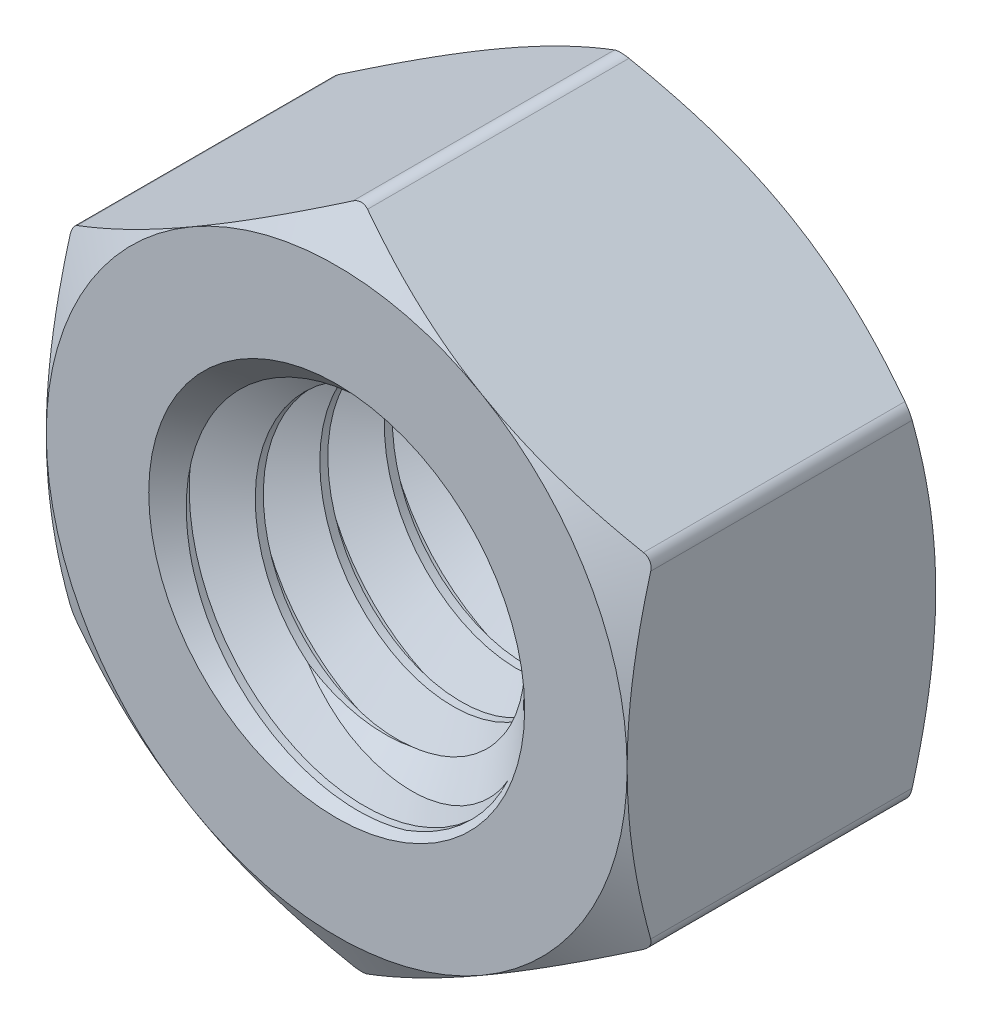
from build123d import *

# Parameters (mm, degrees)
BOSS_EXTRUDE2_DEPTH     = 3.3734375
CUT_EXTRUDE4_DEPTH      = 11.269659873
CUT_EXTRUDE4_DEPTH_BACK = 11.269659873
SKETCH16_R              = 3.96875
SKETCH7_OUTSIDE_W       = 63.202
SKETCH7_OUTSIDE_H       = 65.166
SKETCH7_OUTSIDE_R       = 6.35
CUT_EXTRUDE5_DEPTH      = 12.815504881
CUT_EXTRUDE5_DRAFT      = -60
MIRROR4_COPY_1_SKETCH_W = 63.202
MIRROR4_COPY_1_SKETCH_H = 65.166
MIRROR4_COPY_1_SKETCH_R = 6.35
MIRROR4_COPY_1_DEPTH    = 12.815504881
MIRROR4_COPY_1_DRAFT    = -60
FILLET2_R               = 0.3175
SKETCH13_R              = 3.96875
BOSS_EXTRUDE1_DEPTH     = 6.746875
CUT_SWEEP1_PITCH        = 1.411111111
SKETCH17_R              = 3.96875
BOSS_EXTRUDE3_DEPTH     = 6.746875


with BuildPart() as part:
    # Sketch15 → Boss-Extrude2 (new, symmetric)
    with BuildSketch(Plane.XY):
        Polygon((0, 7.332348419), (-6.35, 3.666174209), (-6.35, -3.666174209), (0, -7.332348419), (6.35, -3.666174209), (6.35, 3.666174209), align=None)
    extrude(amount=BOSS_EXTRUDE2_DEPTH, both=True)

    # Sketch16 → Cut-Extrude4 (cut, two sides: drawn at the far end of the back side and taken through both)
    with BuildSketch(Plane.XY.offset(-CUT_EXTRUDE4_DEPTH_BACK)):
        Circle(SKETCH16_R)
    extrude(amount=CUT_EXTRUDE4_DEPTH + CUT_EXTRUDE4_DEPTH_BACK, mode=Mode.SUBTRACT)


with BuildPart() as cut_extrude5_tool:
    # Sketch7 outside → Cut-Extrude5 (with draft: the straight prism first)
    with BuildSketch(Plane.XY.offset(3.3734375)):
        Rectangle(SKETCH7_OUTSIDE_W, SKETCH7_OUTSIDE_H)
        Circle(SKETCH7_OUTSIDE_R, mode=Mode.SUBTRACT)
    extrude(amount=-CUT_EXTRUDE5_DEPTH)
    # Cut-Extrude5: the draft: its side faces are tilted about the plane it starts from
    cut_extrude5_sides = [cut_extrude5_tool.faces().sort_by_distance(p)[0] for p in [
        (0, -32.583, -3.034314941),
        (31.601, 0, -3.034314941),
        (0, 32.583, -3.034314941),
        (-31.601, 0, -3.034314941),
        (-6.35, 0, -3.034314941),
    ]]
    draft(cut_extrude5_sides, Plane.XY.offset(3.3734375), CUT_EXTRUDE5_DRAFT)


with BuildPart() as part_1:
    add(part.part)

    # Cut-Extrude5: cut by cut_extrude5_tool
    add(cut_extrude5_tool.part, mode=Mode.SUBTRACT)


with BuildPart() as mirror4_copy_1_tool:
    # Mirror4 copy 1 sketch → Mirror4 copy 1 (with draft: the straight prism first)
    with BuildSketch(Plane(origin=(0, 0, -3.3734375), x_dir=(1, 0, 0), z_dir=(0, 0, -1))):
        Rectangle(MIRROR4_COPY_1_SKETCH_W, MIRROR4_COPY_1_SKETCH_H)
        Circle(MIRROR4_COPY_1_SKETCH_R, mode=Mode.SUBTRACT)
    extrude(amount=-MIRROR4_COPY_1_DEPTH)
    # Mirror4 copy 1: the draft: its side faces are tilted about the plane it starts from
    mirror4_copy_1_sides = [mirror4_copy_1_tool.faces().sort_by_distance(p)[0] for p in [
        (0, -32.583, 3.034314941),
        (31.601, 0, 3.034314941),
        (0, 32.583, 3.034314941),
        (-31.601, 0, 3.034314941),
        (-6.35, 0, 3.034314941),
    ]]
    draft(mirror4_copy_1_sides, Plane(origin=(0, 0, -3.3734375), x_dir=(1, 0, 0), z_dir=(0, 0, -1)), MIRROR4_COPY_1_DRAFT)


with BuildPart() as part_2:
    add(part_1.part)

    # Mirror4 copy 1: cut by mirror4_copy_1_tool
    add(mirror4_copy_1_tool.part, mode=Mode.SUBTRACT)

    # Fillet2
    fillet2_edges = [part_2.edges().sort_by_distance(p)[0] for p in [
        (-6.35, 3.666174209, 0),
        (-6.35, -3.666174209, 0),
        (0, -7.332348419, 0),
        (6.35, -3.666174209, 0),
        (6.35, 3.666174209, 0),
        (0, 7.332348419, 0),
    ]]
    fillet(fillet2_edges, radius=FILLET2_R)

    # Sketch17 → Boss-Extrude3 (add)
    with BuildSketch(Plane.XY.offset(3.3734375)):
        Circle(SKETCH17_R)
    extrude(amount=-BOSS_EXTRUDE3_DEPTH)


with BuildPart() as body_2:
    # Sketch13 → Boss-Extrude1 (new body)
    with BuildSketch(Plane(origin=(0, 0, -3.3734375), x_dir=(-1, 0, 0), z_dir=(0, 0, -1))):
        Circle(SKETCH13_R)
    extrude(amount=-BOSS_EXTRUDE1_DEPTH)

    # Cut-Sweep1: the profile of Sketch12 profile screwed along a right-hand helix of 5.78125 turns, 8 arcs to a turn; built about Z, then put on its axis
    cut_sweep1_z = Axis((0, 0, 0), (0, 0, 1))
    cut_sweep1_corners = [(3.96905, 0, -1.234895427), (3.96905, 0, 0.000173205), (3.052206448, 0, -0.529166667), (3.052206448, 0, -0.705555556)]
    with BuildLine(mode=Mode.PRIVATE) as cut_sweep1_profile:
        Line(cut_sweep1_corners[0], cut_sweep1_corners[1])
        Line(cut_sweep1_corners[1], cut_sweep1_corners[2])
        Line(cut_sweep1_corners[2], cut_sweep1_corners[3])
        Line(cut_sweep1_corners[3], cut_sweep1_corners[0])
    cut_sweep1_cap = Face(cut_sweep1_profile.wire())
    cut_sweep1_turn_angles = [0, 22.5, 45, 67.5, 90, 112.5, 135, 157.5, 180, 202.5, 225, 247.5, 270, 292.5, 315, 337.5, 360]
    cut_sweep1_turn_weights = [1, 0.9238795325112867, 1, 0.9238795325112867, 1, 0.9238795325112867, 1, 0.9238795325112867, 1, 0.9238795325112867, 1, 0.9238795325112867, 1, 0.9238795325112867, 1, 0.9238795325112867, 1]
    cut_sweep1_turn_rails = [Edge.make_bspline([Vector(p[0], p[1], 0).rotate(cut_sweep1_z, cut_sweep1_turn_angles[k]) / cut_sweep1_turn_weights[k] + Vector(0, 0, p[2] + CUT_SWEEP1_PITCH * cut_sweep1_turn_angles[k] / 360) for k in range(17)], [0, 0, 0, 1, 1, 2, 2, 3, 3, 4, 4, 5, 5, 6, 6, 7, 7, 8, 8, 8], 2, cut_sweep1_turn_weights) for p in cut_sweep1_corners]
    cut_sweep1_turn_sides = [Face.make_surface_from_curves(cut_sweep1_turn_rails[p[0]], cut_sweep1_turn_rails[p[1]]) for p in [(0, 1), (1, 2), (2, 3), (3, 0)]]
    cut_sweep1_last_angles = [1800, 1822.5, 1845, 1867.5, 1890, 1912.5, 1935, 1957.5, 1980, 2002.5, 2025, 2047.5, 2070, 2075.625, 2081.25]
    cut_sweep1_last_weights = [1, 0.9238795325112867, 1, 0.9238795325112867, 1, 0.9238795325112867, 1, 0.9238795325112867, 1, 0.9238795325112867, 1, 0.9238795325112867, 1, 0.9951847266722058, 1]
    cut_sweep1_last_rails = [Edge.make_bspline([Vector(p[0], p[1], 0).rotate(cut_sweep1_z, cut_sweep1_last_angles[k]) / cut_sweep1_last_weights[k] + Vector(0, 0, p[2] + CUT_SWEEP1_PITCH * cut_sweep1_last_angles[k] / 360) for k in range(15)], [0, 0, 0, 1, 1, 2, 2, 3, 3, 4, 4, 5, 5, 6, 6, 7, 7, 7], 2, cut_sweep1_last_weights) for p in cut_sweep1_corners]
    cut_sweep1_last_sides = [Face.make_surface_from_curves(cut_sweep1_last_rails[p[0]], cut_sweep1_last_rails[p[1]]) for p in [(0, 1), (1, 2), (2, 3), (3, 0)]]
    cut_sweep1 = Plane(origin=(0, 0, -3.3734375), x_dir=(0, 1, 0), z_dir=(0, 0, 1)) * Solid(Shell([*[p.moved(Location((0, 0, CUT_SWEEP1_PITCH * i))) for i in range(5) for p in cut_sweep1_turn_sides], *cut_sweep1_last_sides, cut_sweep1_cap, cut_sweep1_cap.rotate(cut_sweep1_z, 2081.25).moved(Location((0, 0, CUT_SWEEP1_PITCH * 2081.25 / 360)))]))
    add(cut_sweep1, mode=Mode.SUBTRACT)


with BuildPart() as part_3:
    add(part_2.part)

    # Combine1: cut body 2
    add(body_2.part, mode=Mode.SUBTRACT)

    # Cut-Extrude2 cone 1 section (through the dimple's axis) → Cut-Extrude2 (revolve, cut)
    with BuildSketch(Plane(origin=(0, 0, 3.3734375), x_dir=(0, -1, 0), z_dir=(1, 0, 0))):
        Polygon((0, 0), (4.109861111, 0), (0, 4.109861111), align=None)
    revolve(axis=Axis((0, 0, 3.3734375), (0, 0, -1)), mode=Mode.SUBTRACT)

    # Cut-Extrude3 cone 1 section (through the dimple's axis) → Cut-Extrude3 (revolve, cut)
    with BuildSketch(Plane(origin=(0, 0, -3.3734375), x_dir=(0, 1, 0), z_dir=(1, 0, 0))):
        Polygon((0, 0), (4.109861111, 0), (0, 4.109861111), align=None)
    revolve(axis=Axis((0, 0, -3.3734375), (0, 0, 1)), mode=Mode.SUBTRACT)


solid = part_3.part
